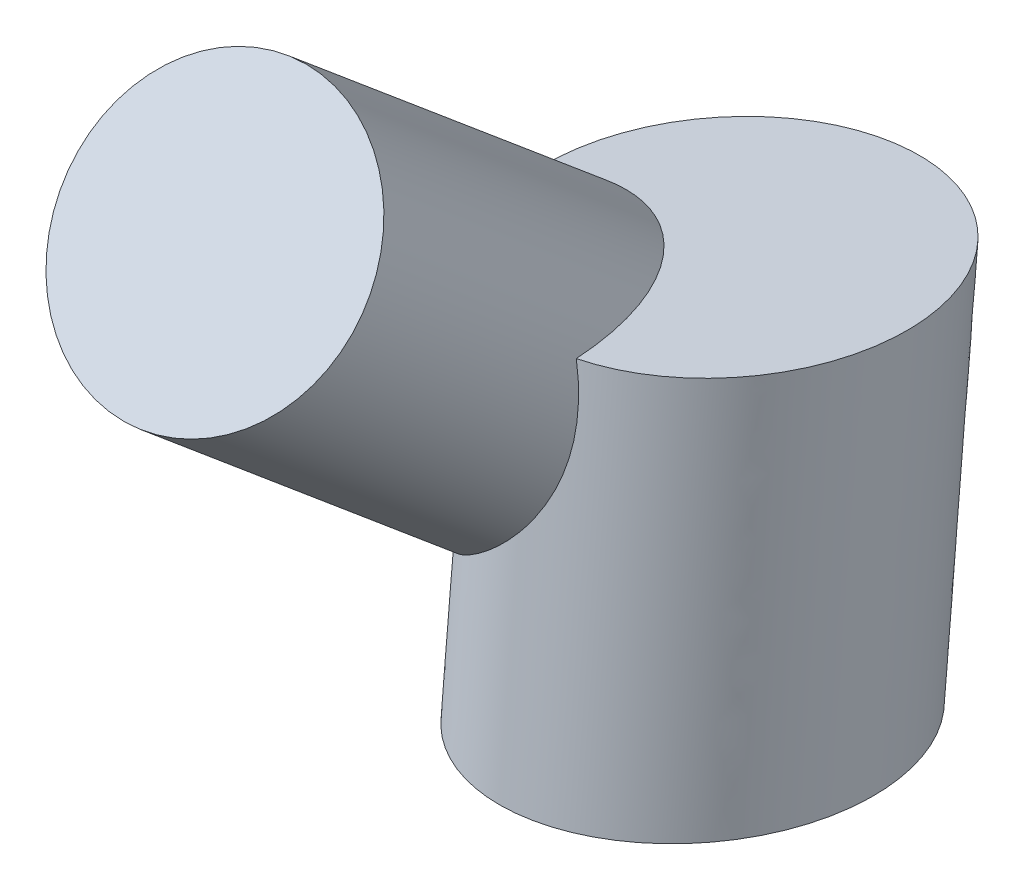
from build123d import *

# Parameters (mm, degrees)
SKETCH45_RX          = 19.05
SKETCH45_RY          = 15.875
BOSS_EXTRUDE15_DEPTH = 38.1


with BuildPart() as part:
    # Sketch45 → Boss-Extrude15 (new body)
    with BuildSketch(Plane(origin=(0, 430.230951134, -37.640330922), x_dir=(1, 0, 0), z_dir=(8.588467854254472e-14, 0.9961946980917457, -0.08715574274765843))):
        with Locations(Location((9.853009976, -14.936278335), (0, 0, -90))):
            Ellipse(SKETCH45_RX, SKETCH45_RY)
    extrude(amount=BOSS_EXTRUDE15_DEPTH)

    # Sketch48 → Revolve1 (revolve)
    with BuildSketch(Plane.ZY):
        Polygon((5.340164668, 495.85367846), (-26.081523434, 469.487751563), (-17.101780527, 458.786110693), (14.319907575, 485.15203759), align=None)
    revolve(axis=Axis((0, 452.498427018, -24.595150135), (0, 0.6427876096865212, 0.7660444431189934)))


solid = part.part
